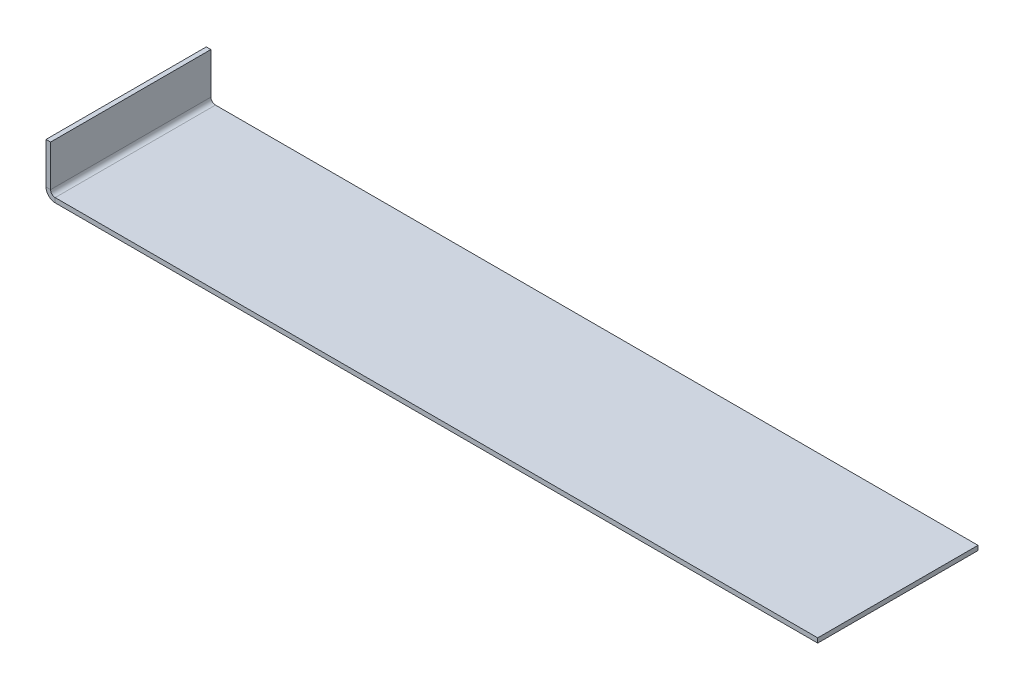
from build123d import *

# Parameters (mm, degrees)
SM_BASE_FLANGE_367_DEPTH = 35


# Sheet-metal steps are written as plain solids
with BuildPart() as part:
    # Sketch 1 → Sm Base Flange 367 (new, symmetric)
    with BuildSketch(Plane.XY):
        with BuildLine():
            Line((0, 20), (0, 2))
            ThreePointArc((0, 2), (0.585786438, 0.585786438), (2, 0))
            Line((2, 0), (335, 0))
            Line((335, 0), (335, -2))
            Line((335, -2), (2, -2))
            ThreePointArc((2, -2), (-0.828427125, -0.828427125), (-2, 2))
            Line((-2, 2), (-2, 20))
            Line((-2, 20), (0, 20))
        make_face()
    extrude(amount=SM_BASE_FLANGE_367_DEPTH, both=True)


solid = part.part
